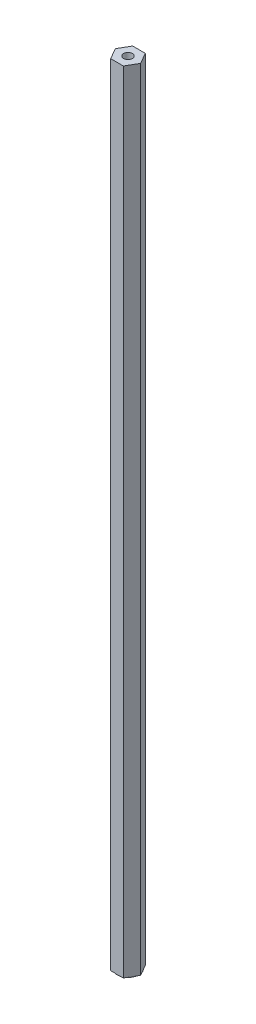
from build123d import *

# Parameters (mm, degrees)
BOSS_EXTRUDE1_DEPTH = 457.2
SKETCH2_R           = 2.54
CUT_EXTRUDE1_DEPTH  = 25.4
SKETCH3_R           = 6.35
BOSS_EXTRUDE2_DEPTH = 0.254


with BuildPart() as part:
    # Sketch1 → Boss-Extrude1 (new body)
    with BuildSketch(Plane(origin=(0, 0, 0), x_dir=(1, 0, 0), z_dir=(0, 1, 0))):
        Polygon((7.332348419, 0), (3.666174209, 6.35), (-3.666174209, 6.35), (-7.332348419, 0), (-3.666174209, -6.35), (3.666174209, -6.35), align=None)
    extrude(amount=BOSS_EXTRUDE1_DEPTH)

    # Sketch2 → Cut-Extrude1 (cut)
    with BuildSketch(Plane(origin=(0, 457.2, 0), x_dir=(1, 0, 0), z_dir=(0, 1, 0))):
        Circle(SKETCH2_R)
    extrude(amount=-CUT_EXTRUDE1_DEPTH, mode=Mode.SUBTRACT)

    # Sketch3 → Boss-Extrude2 (add)
    with BuildSketch(Plane.XZ):
        Circle(SKETCH3_R)
    extrude(amount=BOSS_EXTRUDE2_DEPTH)


solid = part.part
